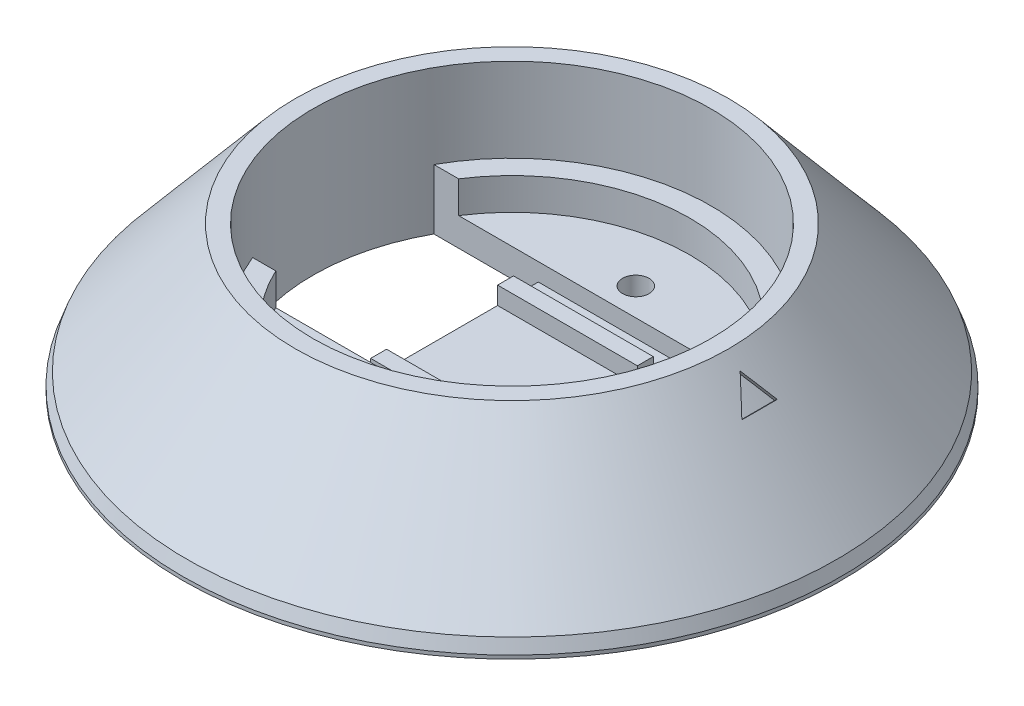
from build123d import *
from build123d.topology import SkipClean

# Parameters (mm, degrees)
SKETCH1_R           = 37.25
BOSS_EXTRUDE1_DEPTH = 1.2
SKETCH2_R           = 20.1
SKETCH2_W           = 26.3
SKETCH2_H           = 19.35
SKETCH2_W_2         = 15.8
SKETCH2_H_2         = 1.8
BOSS_EXTRUDE3_DEPTH = 2
SKETCH2_5_R         = 22.5
SKETCH2_5_R_2       = 20.1
BOSS_EXTRUDE4_DEPTH = 5.6
SKETCH2_7_R         = 22.5
SKETCH2_7_R_2       = 20.1
SKETCH2_7_W         = 26.3
SKETCH2_7_H         = 19.35
SKETCH2_7_W_2       = 15.8
SKETCH2_7_H_2       = 1.8
CUT_EXTRUDE1_DEPTH  = 55.800866781
CUT_EXTRUDE2_DEPTH  = 54.52919764
SKETCH8_R           = 1.5
CUT_EXTRUDE3_DEPTH  = 55.283837374
CUT_EXTRUDE4_DEPTH  = 54.52919764
CUT_EXTRUDE5_REACH  = 74.76


with BuildPart() as part:
    # Sketch1 → Boss-Extrude1 (new body)
    with BuildSketch(Plane(origin=(0, 0, 0), x_dir=(1, 0, 0), z_dir=(0, 1, 0))):
        with Locations(Location((0, 0, 0), (0, 0, 270))):
            Circle(SKETCH1_R)
    extrude(amount=BOSS_EXTRUDE1_DEPTH)

    # Sketch2 → Boss-Extrude3 (add)
    # profile 1 of 3: a face of its own
    with BuildSketch(Plane(origin=(0, 1.2, 0), x_dir=(1, 0, 0), z_dir=(0, 1, 0))):
        with Locations(Location((0, 0, 0), (0, 0, 270))):
            Circle(SKETCH2_R)
        with Locations((-2.45, 1.2)):
            Rectangle(SKETCH2_W, SKETCH2_H, mode=Mode.SUBTRACT)
    # profile 2 of 3: a face of its own
    with BuildSketch(Plane(origin=(0, 1.2, 0), x_dir=(1, 0, 0), z_dir=(0, 1, 0))):
        with Locations((0, 7.175)):
            Rectangle(SKETCH2_W_2, SKETCH2_H_2)
    # profile 3 of 3: a face of its own
    with BuildSketch(Plane(origin=(0, 1.2, 0), x_dir=(1, 0, 0), z_dir=(0, 1, 0))):
        with Locations((0, -7.175)):
            Rectangle(SKETCH2_W_2, SKETCH2_H_2)
    extrude(amount=BOSS_EXTRUDE3_DEPTH)

    # Sketch2<5> → Boss-Extrude4 (add)
    with BuildSketch(Plane(origin=(0, 1.2, 0), x_dir=(1, 0, 0), z_dir=(0, 1, 0))):
        with Locations(Location((0, 0, 0), (0, 0, 270))):
            Circle(SKETCH2_5_R)
        with Locations(Location((0, 0, 0), (0, 0, 270))):
            Circle(SKETCH2_5_R_2, mode=Mode.SUBTRACT)
    extrude(amount=BOSS_EXTRUDE4_DEPTH)


with BuildPart() as body_2:
    # Loft1: read off the stored shape, not the designer's step
    # Loft1 outline → Loft1 (revolve)
    with BuildSketch(Plane.XY):
        Polygon((0, 16.3), (0, 1.2), (37.25, 1.2), (24.5, 16.3), align=None)
    revolve(axis=Axis((0, 0, 0), (0, 1, 0)))

    # Sketch2<7> → Cut-Extrude1 (cut, through all)
    # profile 1 of 5: a face of its own
    with BuildSketch(Plane(origin=(0, 1.2, 0), x_dir=(1, 0, 0), z_dir=(0, 1, 0))):
        with Locations(Location((0, 0, 0), (0, 0, 90))):
            Circle(SKETCH2_7_R)
        with Locations(Location((0, 0, 0), (0, 0, 270))):
            Circle(SKETCH2_7_R_2, mode=Mode.SUBTRACT)
    # profile 2 of 5: a face of its own
    with BuildSketch(Plane(origin=(0, 1.2, 0), x_dir=(1, 0, 0), z_dir=(0, 1, 0))):
        with Locations(Location((0, 0, 0), (0, 0, 270))):
            Circle(SKETCH2_7_R_2)
        with Locations((-2.45, 1.2)):
            Rectangle(SKETCH2_7_W, SKETCH2_7_H, mode=Mode.SUBTRACT)
    # profile 3 of 5: a face of its own
    with BuildSketch(Plane(origin=(0, 1.2, 0), x_dir=(1, 0, 0), z_dir=(0, 1, 0))):
        with Locations((-2.45, 1.2)):
            Rectangle(SKETCH2_7_W, SKETCH2_7_H)
        with Locations((0, 7.175)):
            Rectangle(SKETCH2_7_W_2, SKETCH2_7_H_2, mode=Mode.SUBTRACT)
        with Locations((0, -7.175)):
            Rectangle(SKETCH2_7_W_2, SKETCH2_7_H_2, mode=Mode.SUBTRACT)
    # profile 4 of 5: a face of its own
    with BuildSketch(Plane(origin=(0, 1.2, 0), x_dir=(1, 0, 0), z_dir=(0, 1, 0))):
        with Locations((0, 7.175)):
            Rectangle(SKETCH2_7_W_2, SKETCH2_7_H_2)
    # profile 5 of 5: a face of its own
    with BuildSketch(Plane(origin=(0, 1.2, 0), x_dir=(1, 0, 0), z_dir=(0, 1, 0))):
        with Locations((0, -7.175)):
            Rectangle(SKETCH2_7_W_2, SKETCH2_7_H_2)
    extrude(amount=CUT_EXTRUDE1_DEPTH, mode=Mode.SUBTRACT)


with BuildPart() as part_1:
    add(part.part)

    # Combine1: union body 2
    add(body_2.part)

    # Sketch7 → Cut-Extrude2 (cut, through all)
    with BuildSketch(Plane(origin=(0, 6.8, 0), x_dir=(1, 0, 0), z_dir=(0, 1, 0))):
        with BuildLine():
            Line((-7.9, 10.875), (-7.9, -8.475))
            Line((-7.9, -8.475), (-20.842849493, -8.475))
            ThreePointArc((-20.842849493, -8.475), (-22.460675412, 1.329684188), (-19.69731898, 10.875))
            Line((-19.69731898, 10.875), (-7.9, 10.875))
        make_face()
    extrude(amount=-CUT_EXTRUDE2_DEPTH, mode=Mode.SUBTRACT)

    # Sketch8 → Cut-Extrude3 (cut, through all)
    with BuildSketch(Plane(origin=(0, 3.2, 0), x_dir=(1, 0, 0), z_dir=(0, 1, 0))):
        with Locations(Location((0, 14, 0), (0, 0, 270))):
            Circle(SKETCH8_R)
        with Locations(Location((0, -14, 0), (0, 0, 270))):
            Circle(SKETCH8_R)
    extrude(amount=-CUT_EXTRUDE3_DEPTH, mode=Mode.SUBTRACT)

    # Sketch9 → Cut-Extrude4 (cut, through all)
    with SkipClean():  # the faces are left unmerged after this step: merging them gives an invalid solid
        with BuildSketch(Plane(origin=(0, 6.8, 0), x_dir=(1, 0, 0), z_dir=(0, 1, 0))):
            with BuildLine():
                Line((7.9, 10.875), (7.9, -8.475))
                Line((7.9, -8.475), (20.842849493, -8.475))
                ThreePointArc((20.842849493, -8.475), (22.460675412, 1.329684188), (19.69731898, 10.875))
                Line((19.69731898, 10.875), (7.9, 10.875))
            make_face()
        extrude(amount=-CUT_EXTRUDE4_DEPTH, mode=Mode.SUBTRACT)

    # Chamfer1: read off the stored shape, not the designer's step
    # Chamfer1 outline → Chamfer1 (revolve, cut)
    with SkipClean():  # the faces are left unmerged after this step: merging them gives an invalid solid
        with BuildSketch(Plane.XY):
            Polygon((37.25, 1.806111173), (36.738217387, 1.806111173), (37.25, 0.4), align=None)
        revolve(axis=Axis((0, 0, 0), (0, 1, 0)), mode=Mode.SUBTRACT)

    # Cut-Extrude5: up to this cone (the profile starts outside it)
    with SkipClean():  # the faces are left unmerged after this step: merging them gives an invalid solid
        cut_extrude5_end = Plane(origin=(0, 13.007369, 0), z_dir=(0, -1, 0)).offset(-31.6883035) * Cone(1e-06, 112.896593677, 133.704984453, align=(Align.CENTER, Align.CENTER, Align.MIN), mode=Mode.PRIVATE)
        # Sketch10 → Cut-Extrude5 (cut, up to the surface)
        with BuildSketch(Plane(origin=(22.337472556, 18.861110933, 0), x_dir=(0, 0, -1), z_dir=(0.7640576290946525, 0.6451479980766108, 0)), mode=Mode.PRIVATE) as cut_extrude5_sk1:
            Polygon((0, -5.351986599), (-2, -8.816088214), (2, -8.816088214), align=None)
        cut_extrude5_tool1 = extrude(cut_extrude5_sk1.sketch, amount=-CUT_EXTRUDE5_REACH, mode=Mode.PRIVATE) - cut_extrude5_end
        add(cut_extrude5_tool1.solids().sort_by_distance((27.280201, 13.007369, 0))[0], mode=Mode.SUBTRACT)


solid = part_1.part
